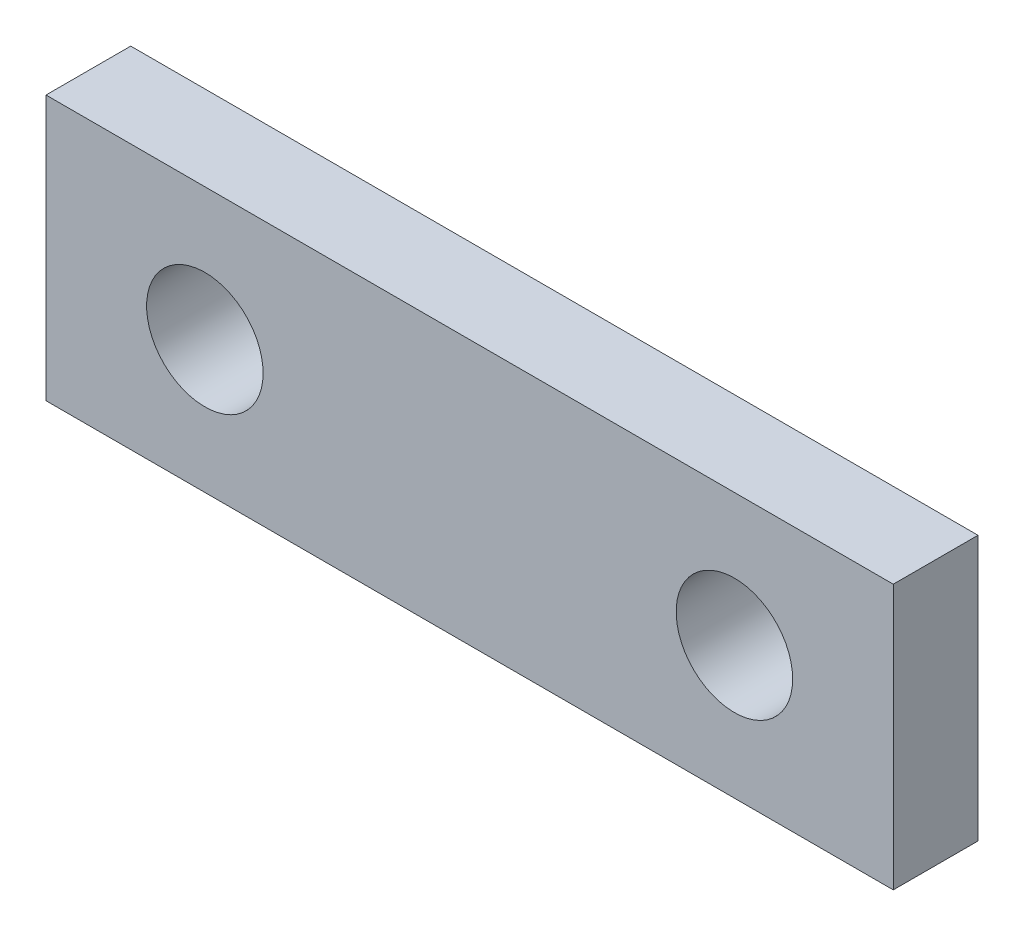
from build123d import *

# Parameters (mm, degrees)
SKIZZE1_W                       = 80
SKIZZE1_H                       = 25
SKIZZE1_R                       = 5.5
AUFSATZ_LINEAR_AUSTRAGEN1_DEPTH = 4


with BuildPart() as part:
    # Skizze1 → Aufsatz-Linear austragen1 (new, symmetric)
    with BuildSketch(Plane.XY):
        Rectangle(SKIZZE1_W, SKIZZE1_H)
        with Locations((-25, 0)):
            Circle(SKIZZE1_R, mode=Mode.SUBTRACT)
        with Locations((25, 0)):
            Circle(SKIZZE1_R, mode=Mode.SUBTRACT)
    extrude(amount=AUFSATZ_LINEAR_AUSTRAGEN1_DEPTH, both=True)


solid = part.part
